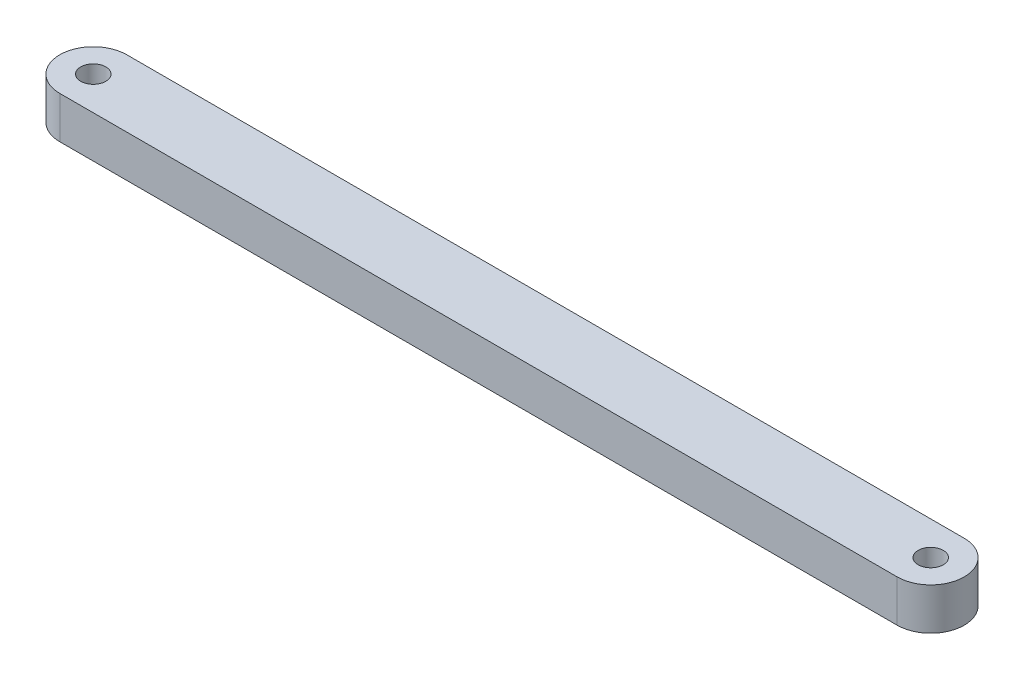
from build123d import *

# Parameters (mm, degrees)
SKETCH1_R           = 1.5
BOSS_EXTRUDE1_DEPTH = 5


with BuildPart() as part:
    # Sketch1 → Boss-Extrude1 (new body)
    with BuildSketch(Plane(origin=(0, 0, 0), x_dir=(1, 0, 0), z_dir=(0, 1, 0))):
        with BuildLine():
            Line((-50, 4), (50, 4))
            ThreePointArc((50, 4), (54, 0), (50, -4))
            Line((50, -4), (-50, -4))
            ThreePointArc((-50, -4), (-54, 0), (-50, 4))
        make_face()
        with Locations((-50, 0)):
            Circle(SKETCH1_R, mode=Mode.SUBTRACT)
        with Locations((50, 0)):
            Circle(SKETCH1_R, mode=Mode.SUBTRACT)
    extrude(amount=BOSS_EXTRUDE1_DEPTH)


solid = part.part
